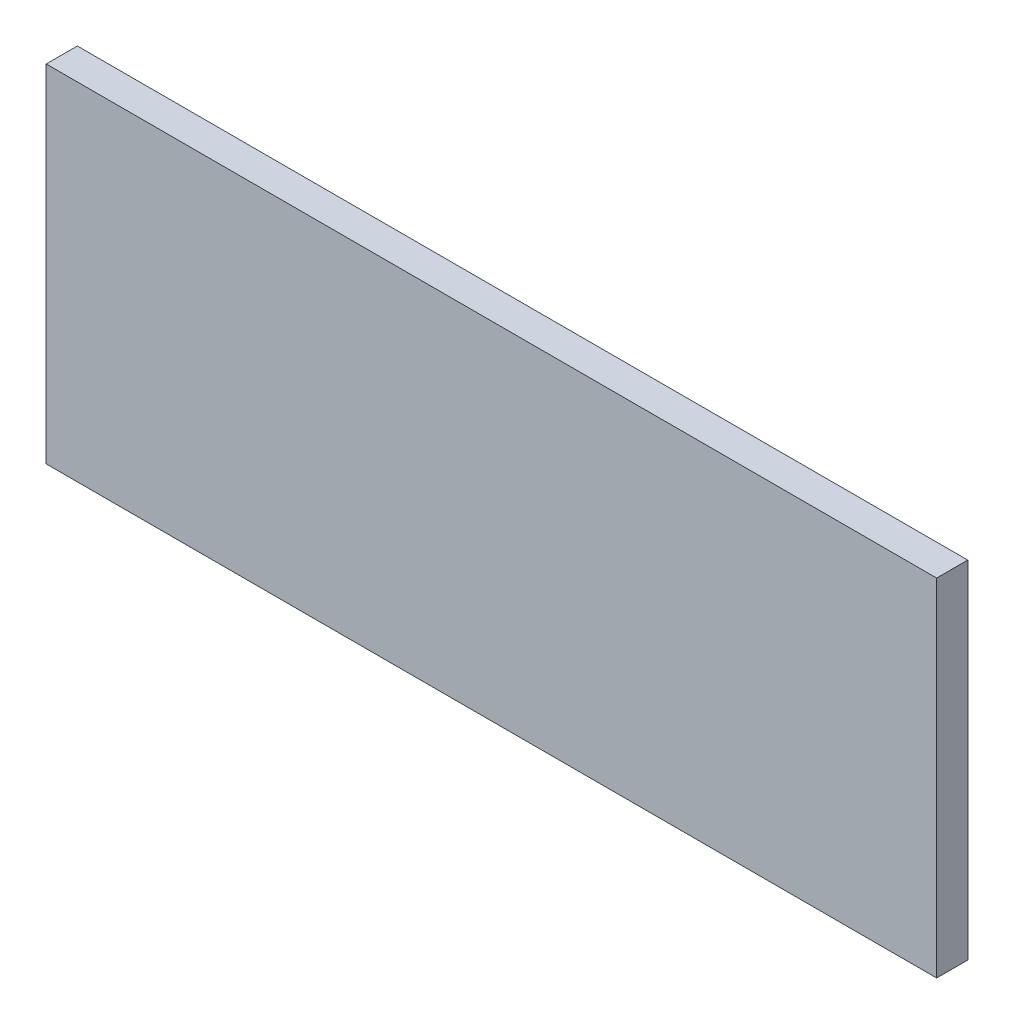
from build123d import *

# Parameters (mm, degrees)
SKETCH1_W           = 72.674083076
SKETCH1_H           = 28.271195995
BOSS_EXTRUDE1_DEPTH = 2.54


with BuildPart() as part:
    # Sketch1 → Boss-Extrude1 (new body)
    with BuildSketch(Plane.XY):
        with Locations((36.337041538, 14.135597998)):
            Rectangle(SKETCH1_W, SKETCH1_H)
    extrude(amount=BOSS_EXTRUDE1_DEPTH)


solid = part.part
